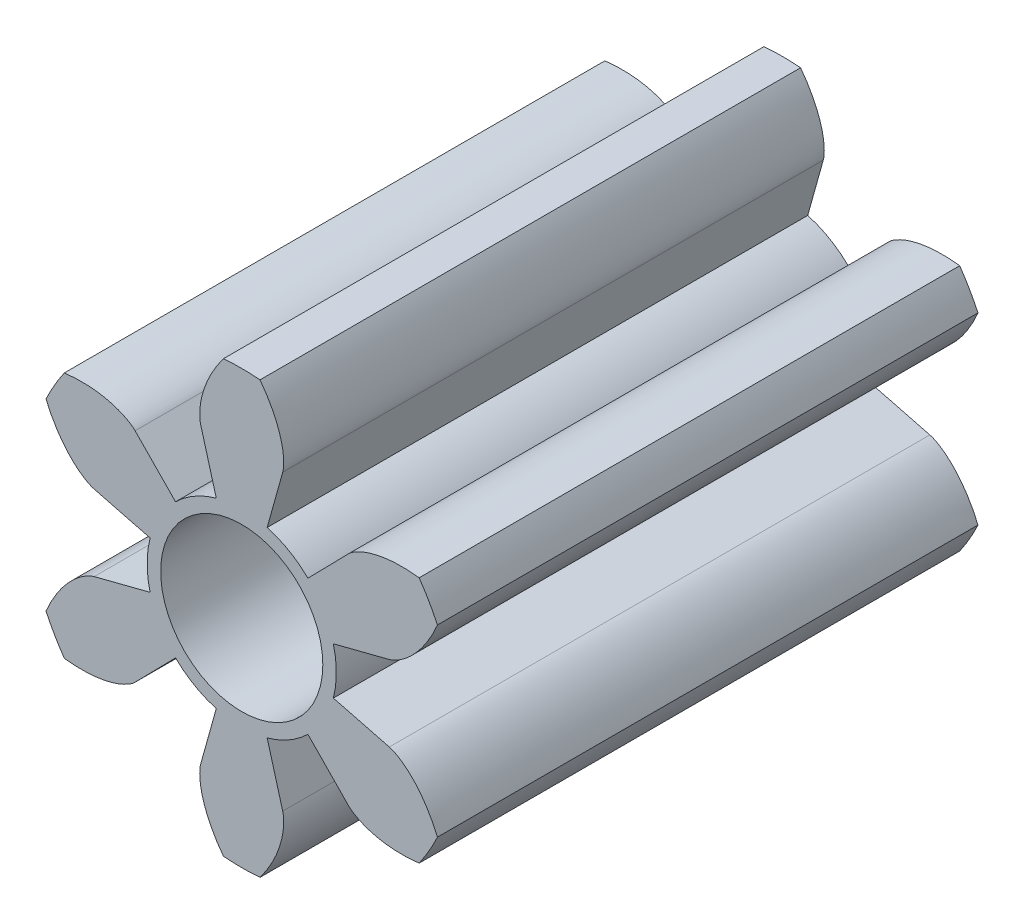
from build123d import *

# Parameters (mm, degrees)
SKETCH_1_R               = 4
SKETCH_1_R_2             = 1.5
EXTRUDE_1_DEPTH          = 10
CUT_EXTRUDE_1_DEPTH      = 12.489125293
PATTERN_CIRCULAR_1_COUNT = 6
PATTERN_CIRCULAR_1_ANGLE = 300


with BuildPart() as part:
    # 草图1 → 凸台-拉伸1 (new body)
    with BuildSketch(Plane.XY):
        Circle(SKETCH_1_R)
        Circle(SKETCH_1_R_2, mode=Mode.SUBTRACT)
    extrude(amount=EXTRUDE_1_DEPTH)

    # 草图1<3> → 切除-拉伸1 (cut, through all)
    with BuildSketch(Plane.XY):
        with BuildLine():
            Line((2.730540893, 0.700961074), (1.695038873, 0.435135863))
            ThreePointArc((1.695038873, 0.435135863), (1.736205349, 0.219296571), (1.75, 0))
            ThreePointArc((1.75, 0), (1.736205349, -0.219296571), (1.695038873, -0.435135863))
            Line((1.695038873, -0.435135863), (2.730540893, -0.700961074))
            add(Edge.make_bspline(
                [(2.730540893, -0.700961074), (2.751355068, -0.706304311), (2.808329953, -0.725541446), (2.910522768, -0.778982289), (3.06267796, -0.887491262), (3.235956594, -1.057334282), (3.408810129, -1.2831446), (3.52264255, -1.482702951), (3.589508983, -1.625182096), (3.620975996, -1.699568426)],
                knots=[0, 0, 0, 0, 0, 0.005604068, 0.015718248, 0.029959916, 0.048733667, 0.068727063, 0.089838728, 0.089838728, 0.089838728, 0.089838728, 0.089838728], degree=4))
            ThreePointArc((3.620975996, -1.699568426), (3.90409426, -0.870659525), (4, 0))
            ThreePointArc((4, 0), (3.90409426, 0.870659525), (3.620975996, 1.699568426))
            add(Edge.make_bspline(
                [(2.730540893, 0.700961074), (2.751355068, 0.706304311), (2.808329953, 0.725541446), (2.910522768, 0.778982289), (3.06267796, 0.887491262), (3.235956594, 1.057334282), (3.408810129, 1.2831446), (3.52264255, 1.482702951), (3.589508983, 1.625182096), (3.620975996, 1.699568426)],
                knots=[0, 0, 0, 0, 0, 0.005604068, 0.015718248, 0.029959916, 0.048733667, 0.068727063, 0.089838728, 0.089838728, 0.089838728, 0.089838728, 0.089838728], degree=4))
        make_face()
    cut_extrude_1 = extrude(amount=CUT_EXTRUDE_1_DEPTH, mode=Mode.SUBTRACT)

    # 阵列(圆周)1: 切除-拉伸1 ×6 about axis
    pattern_circular_1_axis = Axis((0, 0, 10), (0, 0, 1))
    for i in range(1, PATTERN_CIRCULAR_1_COUNT):
        add(cut_extrude_1.rotate(pattern_circular_1_axis, i * PATTERN_CIRCULAR_1_ANGLE / (PATTERN_CIRCULAR_1_COUNT - 1)), mode=Mode.SUBTRACT)


solid = part.part
